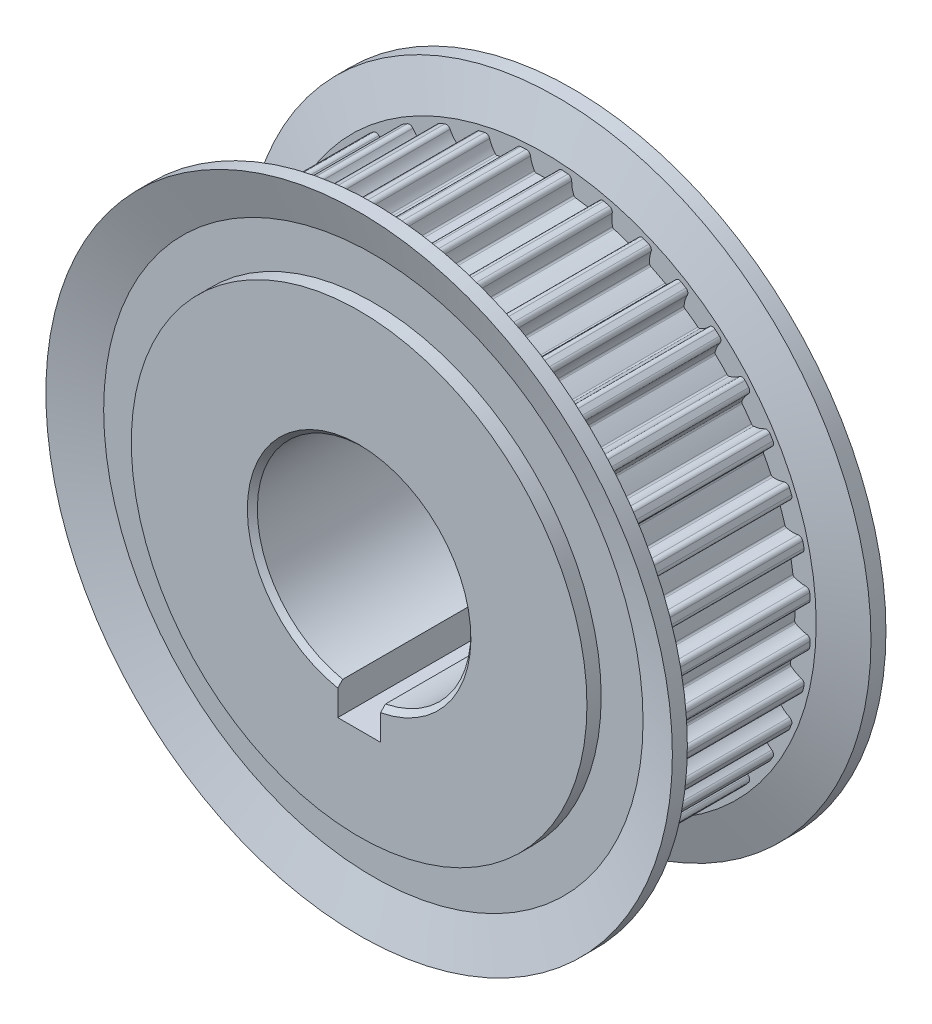
from build123d import *

# Parameters (mm, degrees)
EXTRUDE_1_DEPTH          = 5.5
PATTERN_CIRCULAR_1_COUNT = 40
CUT_EXTRUDE_1_DEPTH      = 33.003906012
CUT_EXTRUDE_1_DEPTH_BACK = 33.003906012
SKETCH_6_R               = 7.5
CHAMFER_1_SIZE           = 0.35
SKETCH_28_W              = 3
SKETCH_28_H              = 4
CUT_EXTRUDE_10_DEPTH     = 35.539832078


with BuildPart() as part:
    # 草图3 → 旋转1 (revolve)
    with BuildSketch(Plane(origin=(0, 0, 0), x_dir=(0, 0, -1), z_dir=(1, 0, 0))):
        Polygon((7.5, 0), (7.5, 16), (6.5, 16), (6.5, 18.940710283), (7.5, 22), (6.447932451, 22), (5.5, 19.1), (5.5, 17.6), (-5.5, 17.6), (-5.5, 19.1), (-6.447932451, 22), (-7.5, 22), (-6.5, 18.940710283), (-6.5, 16), (-7.5, 16), (-7.5, 0), align=None)
    revolve(axis=Axis((0, 0, 7.5), (0, 0, -1)))

    # 草图4 → 凸台-拉伸1 (add, symmetric)
    with BuildSketch(Plane.XY):
        with BuildLine():
            ThreePointArc((-1.269810781, 18.676883589), (-1.468754272, 18.662292487), (-1.667530989, 18.645582329))
            ThreePointArc((-1.667530989, 18.645582329), (-1.858080179, 18.549812804), (-1.931611409, 18.349628004))
            ThreePointArc((-1.931611409, 18.349628004), (-1.963515241, 17.944424411), (-2.07769221, 17.55433285))
            ThreePointArc((-2.07769221, 17.55433285), (-2.125287008, 17.492018457), (-2.197820984, 17.462233045))
            ThreePointArc((-2.197820984, 17.462233045), (-1.380880085, 17.545745074), (-0.560932924, 17.591058929))
            ThreePointArc((-0.560932924, 17.591058929), (-0.637233351, 17.60913082), (-0.693990297, 17.663232553))
            ThreePointArc((-0.693990297, 17.663232553), (-0.867785323, 18.030660226), (-0.962684173, 18.425884231))
            ThreePointArc((-0.962684173, 18.425884231), (-1.066625913, 18.612101605), (-1.269810781, 18.676883589))
        make_face()
    extrude_1 = extrude(amount=EXTRUDE_1_DEPTH, both=True)

    # 阵列(圆周)1: 凸台-拉伸1 ×40 about axis
    pattern_circular_1_axis = Axis((0, 0, 7.5), (0, 0, 1))
    for i in range(1, PATTERN_CIRCULAR_1_COUNT):
        add(extrude_1.rotate(pattern_circular_1_axis, i * 360 / PATTERN_CIRCULAR_1_COUNT))

    # 草图6 → 切除-拉伸1 (cut, two sides: drawn at the far end of the back side and taken through both)
    with BuildSketch(Plane.XY.offset(-CUT_EXTRUDE_1_DEPTH_BACK)):
        Circle(SKETCH_6_R)
    extrude(amount=CUT_EXTRUDE_1_DEPTH + CUT_EXTRUDE_1_DEPTH_BACK, mode=Mode.SUBTRACT)

    # 倒角1
    chamfer_1_edges = [part.edges().sort_by_distance(p)[0] for p in [
        (-7.5, 0, -7.5),
        (-7.5, 0, 7.5),
    ]]
    chamfer(chamfer_1_edges, length=CHAMFER_1_SIZE)

    # 草图28 → 切除-拉伸10 (cut, through all)
    with BuildSketch(Plane(origin=(0, 0, -7.5), x_dir=(-1, 0, 0), z_dir=(0, 0, -1))):
        with Locations((0, -7.5)):
            Rectangle(SKETCH_28_W, SKETCH_28_H)
    extrude(amount=-CUT_EXTRUDE_10_DEPTH, mode=Mode.SUBTRACT)


solid = part.part
